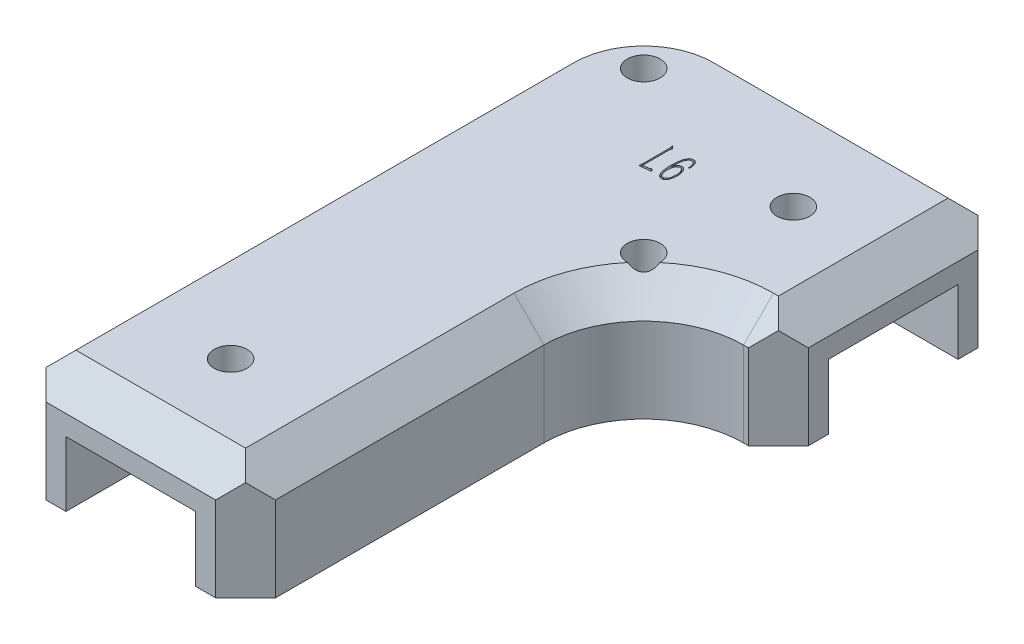
from build123d import *

# Parameters (mm, degrees)
SKETCH_1_W          = 23
SKETCH_1_H          = 23
SKETCH_1_W_2        = 13
SKETCH_1_H_2        = 13
EXTRUDE_1_DEPTH     = 62.9
SKETCH_2_R          = 1.65
CUT_EXTRUDE_1_DEPTH = 34
SKETCH_4_W          = 23
SKETCH_4_H          = 23
SKETCH_4_R          = 3
EXTRUDE_2_DEPTH     = 3.5
SKETCH_5_W          = 23
SKETCH_5_H          = 23
SKETCH_5_W_2        = 13
SKETCH_5_H_2        = 13
EXTRUDE_1_2_DEPTH   = 10
SKETCH_6_R          = 1.65
CUT_EXTRUDE_2_DEPTH = 39
SKETCH_7_W          = 13
SKETCH_7_H          = 13
CUT_EXTRUDE_3_DEPTH = 13
CHAMFER_1_SIZE      = 3
SKETCH_8_W          = 36.5
SKETCH_8_H          = 62.9
CUT_EXTRUDE_4_DEPTH = 11.5
EXTRUDE_3_DEPTH     = 6.5
FILLET_1_R          = 10
FILLET_2_R          = 10
SKETCH_10_R         = 1.65
CUT_EXTRUDE_5_DEPTH = 28.5
CHAMFER_3_SIZE      = 3
CHAMFER_4_SIZE      = 3
CHAMFER_5_SIZE      = 3
CUT_EXTRUDE_6_DEPTH = 0.3


with BuildPart() as part:
    # 草图1 → Extrude 1 (new body)
    with BuildSketch(Plane.XY):
        with Locations((6.5, 6.5)):
            Rectangle(SKETCH_1_W, SKETCH_1_H)
        with Locations((6.5, 6.5)):
            Rectangle(SKETCH_1_W_2, SKETCH_1_H_2, mode=Mode.SUBTRACT)
    extrude(amount=EXTRUDE_1_DEPTH)

    # 草图2 → 切除-拉伸1 (cut)
    with BuildSketch(Plane.XZ.offset(5)):
        with Locations(Location((6.5, 52.9, 0), (0, 0, 270))):
            Circle(SKETCH_2_R)
    extrude(amount=-CUT_EXTRUDE_1_DEPTH, mode=Mode.SUBTRACT)

    # 草图4 → 凸台-拉伸2 (add)
    with BuildSketch(Plane(origin=(18, 0, 0), x_dir=(0, 0, -1), z_dir=(1, 0, 0))):
        with Locations((-11.5, 6.5)):
            Rectangle(SKETCH_4_W, SKETCH_4_H)
        with Locations(Location((-11.5, 6.5, 0), (0, 0, 90))):
            Circle(SKETCH_4_R, mode=Mode.SUBTRACT)
    extrude(amount=EXTRUDE_2_DEPTH)

    # 草图5 → Extrude 1 2 (add)
    with BuildSketch(Plane(origin=(21.5, 0, 0), x_dir=(0, 0, -1), z_dir=(1, 0, 0))):
        with Locations((-11.5, 6.5)):
            Rectangle(SKETCH_5_W, SKETCH_5_H)
        with Locations((-11.5, 6.5)):
            Rectangle(SKETCH_5_W_2, SKETCH_5_H_2, mode=Mode.SUBTRACT)
    extrude(amount=EXTRUDE_1_2_DEPTH)

    # 草图6 → 切除-拉伸2 (cut)
    with BuildSketch(Plane(origin=(0, 18, 0), x_dir=(1, 0, 0), z_dir=(0, 1, 0))):
        with Locations(Location((21.5, -11.5, 0), (0, 0, 270))):
            Circle(SKETCH_6_R)
    extrude(amount=-CUT_EXTRUDE_2_DEPTH, mode=Mode.SUBTRACT)

    # 草图7 → 切除-拉伸3 (cut)
    with BuildSketch(Plane(origin=(21.5, 0, 0), x_dir=(0, 0, -1), z_dir=(1, 0, 0))):
        with Locations((-11.5, 6.5)):
            Rectangle(SKETCH_7_W, SKETCH_7_H)
    extrude(amount=-CUT_EXTRUDE_3_DEPTH, mode=Mode.SUBTRACT)

    # 倒角1
    chamfer_1_edges = [part.edges().sort_by_distance(p)[0] for p in [
        (13, 6.5, 18),
    ]]
    chamfer(chamfer_1_edges, length=CHAMFER_1_SIZE)

    # 草图8 → 切除-拉伸4 (cut)
    with BuildSketch(Plane.XZ.offset(5)):
        with Locations((13.25, 31.45)):
            Rectangle(SKETCH_8_W, SKETCH_8_H)
    extrude(amount=-CUT_EXTRUDE_4_DEPTH, mode=Mode.SUBTRACT)

    # 草图9 → 凸台-拉伸3 (add)
    with BuildSketch(Plane.XZ.offset(-13)):
        Polygon((13, 5), (0, 18), (0, 0), (13, 0), align=None)
    extrude(amount=EXTRUDE_3_DEPTH)

    # 圆角1
    fillet_1_edges = [part.edges().sort_by_distance(p)[0] for p in [
        (-5, 12.25, 0),
    ]]
    fillet(fillet_1_edges, radius=FILLET_1_R)

    # 圆角2
    fillet_2_edges = [part.edges().sort_by_distance(p)[0] for p in [
        (18, 12.25, 23),
    ]]
    fillet(fillet_2_edges, radius=FILLET_2_R)

    # 草图10 → 切除-拉伸5 (cut)
    with BuildSketch(Plane.XZ.offset(-6.5)):
        with Locations(Location((2, 7, 0), (0, 0, 270))):
            Circle(SKETCH_10_R)
        with Locations(Location((18, 23, 0), (0, 0, 270))):
            Circle(SKETCH_10_R)
    extrude(amount=-CUT_EXTRUDE_5_DEPTH, mode=Mode.SUBTRACT)

    # 倒角3
    # the kernel refuses this chamfer: 3 mm, written as the material it takes off along each edge
    with BuildSketch(Plane(origin=(5, 18, 10), x_dir=(0, 0, -1), z_dir=(1, 0, 0))) as chamfer_3_piece_1:
        Polygon((10 - CHAMFER_3_SIZE, 0), (10, -CHAMFER_3_SIZE), (10, 0), align=None)
    revolve(axis=Axis((5, 18, 10), (0, 1, 0)), revolution_arc=90, mode=Mode.SUBTRACT)
    with BuildSketch(Plane(origin=(28, 18, 33), x_dir=(-1, 0, 0), z_dir=(0, 0, 1))) as chamfer_3_piece_2:
        Polygon((10 + CHAMFER_3_SIZE, 0), (10, CHAMFER_3_SIZE), (10, 0), align=None)
    revolve(axis=Axis((28, 18, 33), (0, -1, 0)), revolution_arc=90, mode=Mode.SUBTRACT)
    with BuildSketch(Plane(origin=(28, 18, 23), x_dir=(0, 0.027495876610586768, -0.9996219169112968), z_dir=(1, 0, 0))) as chamfer_3_piece_3:
        Polygon((CHAMFER_3_SIZE * 0.999621916911, -CHAMFER_3_SIZE * 0.0274958766106), (-CHAMFER_3_SIZE * 0.0274958766106, -CHAMFER_3_SIZE * 0.999621916911), (0, 0), align=None)
    extrude(amount=11.215048964, mode=Mode.SUBTRACT)
    with BuildSketch(Plane(origin=(39.215048964, 18, 0), x_dir=(0, 0.027495876610586778, 0.9996219169112968), z_dir=(-1, 0, 0))) as chamfer_3_piece_4:
        Polygon((CHAMFER_3_SIZE * 0.999621916911, -CHAMFER_3_SIZE * 0.0274958766106), (-CHAMFER_3_SIZE * 0.0274958766106, -CHAMFER_3_SIZE * 0.999621916911), (0, 0), align=None)
    extrude(amount=34.215048964, mode=Mode.SUBTRACT)
    with BuildSketch(Plane(origin=(-5, 18, 10), x_dir=(0.9996219169112968, 0.027495876610586778, 0), z_dir=(0, 0, 1))) as chamfer_3_piece_5:
        Polygon((CHAMFER_3_SIZE * 0.999621916911, -CHAMFER_3_SIZE * 0.0274958766106), (-CHAMFER_3_SIZE * 0.0274958766106, -CHAMFER_3_SIZE * 0.999621916911), (0, 0), align=None)
    extrude(amount=60.615048964, mode=Mode.SUBTRACT)
    with BuildSketch(Plane(origin=(18, 18, 33), x_dir=(-0.9996219169112968, 0.02749587661058678, 0), z_dir=(0, 0, 1))) as chamfer_3_piece_6:
        Polygon((CHAMFER_3_SIZE * 0.999621916911, CHAMFER_3_SIZE * 0.0274958766106), (-CHAMFER_3_SIZE * 0.0274958766106, CHAMFER_3_SIZE * 0.999621916911), (0, 0), align=None)
    extrude(amount=37.615048964, mode=Mode.SUBTRACT)

    # 倒角4
    chamfer_4_edges = [part.edges().sort_by_distance(p)[0] for p in [
        (31.5, 18, 11.5),
        (6.5, 18, 62.9),
    ]]
    chamfer(chamfer_4_edges, length=CHAMFER_4_SIZE)

    # 倒角5
    chamfer_5_edges = [part.edges().sort_by_distance(p)[0] for p in [
        (31.5, 10.75, 0),
        (18, 10.75, 62.9),
        (-5, 10.75, 62.9),
        (31.5, 10.75, 23),
    ]]
    chamfer(chamfer_5_edges, length=CHAMFER_5_SIZE)

    # 草图11 → 切除-拉伸6 (cut)
    # profile 1 of 2: a face of its own
    with BuildSketch(Plane(origin=(0, 18, 0), x_dir=(1, 0, 0), z_dir=(0, 1, 0))):
        with BuildLine():
            Line((10.169961689, -12.331537965), (10.205013894, -12.291265218))
            Line((10.205013894, -12.291265218), (10.426514001, -12.567953904))
            add(Edge.make_bspline(
                [(10.426514001, -12.567953904), (10.420112222, -12.579915965), (10.407467454, -12.603543377), (10.386569123, -12.639943921), (10.370185964, -12.685502621), (10.359588371, -12.742805909), (10.35209593, -12.811137632), (10.351500935, -12.860031707), (10.351189049, -12.885661127)],
                knots=[0, 0, 0, 0, 0.736410598, 1.454555069, 2.274010016, 3.348139226, 4.609940921, 6, 6, 6, 6], degree=3))
            Line((10.351189049, -12.885661127), (10.351189049, -15.45267583))
            add(Edge.make_bspline(
                [(10.351189049, -15.45267583), (10.371826596, -15.452896348), (10.409627863, -15.453300265), (10.460307316, -15.45086352), (10.499898624, -15.451081152), (10.532243392, -15.448383736), (10.566728187, -15.443767174), (10.611448589, -15.437841115), (10.671205536, -15.430596017), (10.740781303, -15.42063203), (10.811376358, -15.410141046), (10.873070645, -15.400698583), (10.921027088, -15.392273183), (10.96613794, -15.38446762), (11.010436775, -15.369094836), (11.049310442, -15.340736904), (11.074303969, -15.311966685), (11.093758709, -15.304642687), (11.100709611, -15.302025926)],
                knots=[0, 0, 0, 0, 1.271684107, 2.329311289, 3.126176351, 3.710204741, 4.32783396, 5.270448411, 6.49050515, 8.03759688, 9.602040843, 10.889228832, 11.884182716, 12.602334394, 13.712376462, 14.732953672, 15.547302315, 16, 16, 16, 16], degree=3))
            add(Edge.make_bspline(
                [(11.100709611, -15.302025926), (11.103959736, -15.304489051), (11.113400688, -15.311643929), (11.132267838, -15.327898493), (11.163548601, -15.353676179), (11.201478257, -15.390427651), (11.240409179, -15.42644517), (11.271376905, -15.455066249), (11.293619074, -15.475482172), (11.302231693, -15.496622164), (11.305824587, -15.513703571), (11.306858546, -15.523764644), (11.307293886, -15.528000782)],
                knots=[0, 0, 0, 0, 0.390394386, 1.134016561, 2.38360509, 4.269889804, 6.18981564, 7.453157385, 8.329021544, 9.032311711, 9.592562279, 10, 10, 10, 10], degree=3))
            add(Edge.make_bspline(
                [(11.307293886, -15.528000782), (11.305212221, -15.532796655), (11.301026913, -15.542439033), (11.286239348, -15.55179173), (11.267131043, -15.556758669), (11.233888241, -15.556197885), (11.186258933, -15.554623782), (11.124477681, -15.564210462), (11.05816542, -15.573408269), (11.005527492, -15.581639095), (10.965535977, -15.587447027), (10.936371989, -15.590018683), (10.899642796, -15.594141501), (10.855080644, -15.59744449), (10.802889633, -15.602073636), (10.742973465, -15.607248202), (10.67539132, -15.613397762), (10.627634367, -15.617061001), (10.60252082, -15.618987358)],
                knots=[0, 0, 0, 0, 0.341365878, 0.68633572, 1.116730632, 1.647491765, 2.890856209, 4.29325764, 5.800779701, 7.359923239, 7.845242571, 8.495183841, 9.311733456, 10.309872826, 11.474601469, 12.805924266, 14.320358265, 16, 16, 16, 16], degree=3))
            Line((10.60252082, -15.618987358), (10.391461796, -15.639123731))
            Line((10.391461796, -15.639123731), (10.275118305, -15.648819022))
            add(Edge.make_bspline(
                [(10.275118305, -15.648819022), (10.263007492, -15.652765111), (10.243378711, -15.659160794), (10.214432, -15.655040492), (10.201866673, -15.638282344), (10.192131638, -15.619901093), (10.192866545, -15.591243902), (10.198261256, -15.551485761), (10.205237773, -15.496760287), (10.208454509, -15.455416407), (10.210234436, -15.432539457)],
                knots=[0, 0, 0, 0, 1.058270145, 1.715207142, 2.242218181, 2.723015089, 3.427046488, 4.550153686, 6.091084828, 8, 8, 8, 8], degree=3))
            Line((10.210234436, -15.432539457), (10.219929727, -15.135714398))
            Line((10.219929727, -15.135714398), (10.219929727, -12.869999504))
            add(Edge.make_bspline(
                [(10.219929727, -12.869999504), (10.220035325, -12.841906978), (10.220225034, -12.791438493), (10.219121537, -12.724573471), (10.218920574, -12.674829063), (10.216657144, -12.63033937), (10.213948744, -12.583085364), (10.209857543, -12.52449073), (10.200503917, -12.456208353), (10.187043548, -12.40845637), (10.17965698, -12.382251794)],
                knots=[0, 0, 0, 0, 1.372323329, 2.465391677, 3.267017655, 3.801925377, 4.641299591, 5.579257235, 6.671583216, 8, 8, 8, 8], degree=3))
            Line((10.17965698, -12.382251794), (10.169961689, -12.331537965))
        make_face()
    # profile 2 of 2: a face of its own
    with BuildSketch(Plane(origin=(0, 18, 0), x_dir=(1, 0, 0), z_dir=(0, 1, 0))):
        with BuildLine():
            Line((12.942814875, -13.383849919), (12.872710464, -13.383849919))
            add(Edge.make_bspline(
                [(12.872710464, -13.383849919), (12.867918886, -13.353809877), (12.858438492, -13.294374035), (12.849706726, -13.203550372), (12.83905791, -13.109176046), (12.820825233, -13.009319563), (12.79213831, -12.905502921), (12.751787805, -12.822970037), (12.713616192, -12.761128168), (12.681074416, -12.719772821), (12.643740897, -12.68513145), (12.60383766, -12.655968298), (12.560867121, -12.633421198), (12.515816463, -12.617151626), (12.46800517, -12.609872771), (12.419341648, -12.610331281), (12.37196, -12.615849571), (12.327948721, -12.627325085), (12.288264417, -12.642859648), (12.251427379, -12.663429677), (12.217626053, -12.693175443), (12.182369113, -12.73045195), (12.147000859, -12.779042444), (12.109980412, -12.836434778), (12.074100881, -12.903470073), (12.042445574, -12.979778402), (12.014177787, -13.064293467), (11.981349351, -13.189191417), (11.950908708, -13.356894625), (11.932652427, -13.528473707), (11.924020532, -13.663229848), (11.919736569, -13.753495496), (11.916223971, -13.831794896), (11.915974323, -13.880046822), (11.915859835, -13.902175084)],
                knots=[0, 0, 0, 0, 1.172618578, 2.320089015, 3.517365984, 4.833421129, 6.231766425, 7.655217032, 8.357323983, 9.032478261, 9.676711985, 10.315215253, 10.932648665, 11.54199308, 12.153444918, 12.786093219, 13.413857257, 13.988112725, 14.53457488, 15.054145165, 15.605211832, 16.262994999, 17.029841423, 17.917944275, 18.895673466, 19.956732694, 21.09950916, 22.329492637, 24.933332206, 27.662278065, 28.97833321, 30.139613505, 31.146829503, 32, 32, 32, 32], degree=3))
            Line((11.915859835, -13.902175084), (11.911385086, -14.098318276))
            add(Edge.make_bspline(
                [(11.911385086, -14.098318276), (11.923834505, -14.063189828), (11.946336992, -13.999694701), (11.980887158, -13.912091477), (12.020008929, -13.837807929), (12.065615005, -13.769118356), (12.124632618, -13.705721256), (12.184922335, -13.659402751), (12.241612947, -13.627387084), (12.291956123, -13.609038819), (12.348639061, -13.596364249), (12.388627507, -13.592472653), (12.409573877, -13.590434194)],
                knots=[0, 0, 0, 0, 1.463710204, 2.645675197, 3.693667506, 4.755032446, 5.874045908, 7.078730407, 7.725382873, 8.423483439, 9.174203962, 10, 10, 10, 10], degree=3))
            add(Edge.make_bspline(
                [(12.409573877, -13.590434194), (12.439835126, -13.591591348), (12.497383672, -13.593791936), (12.580232678, -13.618560704), (12.657683928, -13.662024086), (12.717344383, -13.715168011), (12.765506198, -13.767614813), (12.800980306, -13.815640946), (12.83559675, -13.86996529), (12.880092113, -13.951367182), (12.928072791, -14.062381272), (12.96274157, -14.181006946), (12.980750115, -14.281516051), (12.992492769, -14.362531543), (12.998711178, -14.448994823), (13.002334613, -14.569872825), (13.000558726, -14.720743995), (12.992331534, -14.840657004), (12.988308163, -14.899298459)],
                knots=[0, 0, 0, 0, 0.909148716, 1.728949998, 2.576991438, 3.564625719, 4.121218537, 4.72026629, 5.360049571, 6.060456872, 7.512703724, 8.993852322, 9.770776208, 10.587253518, 11.458483217, 12.380006039, 14.229702395, 16, 16, 16, 16], degree=3))
            add(Edge.make_bspline(
                [(12.988308163, -14.899298459), (12.983608116, -14.929675901), (12.973860322, -14.992678041), (12.953205559, -15.089864753), (12.927868491, -15.19309581), (12.898759968, -15.298586031), (12.865056127, -15.398748972), (12.820466317, -15.484106806), (12.766539325, -15.551118503), (12.70422983, -15.597317433), (12.642693157, -15.627760558), (12.587657462, -15.651328091), (12.539752875, -15.66833624), (12.509108536, -15.672365551), (12.495339912, -15.674175937)],
                knots=[0, 0, 0, 0, 1.110217054, 2.302565578, 3.587623031, 4.949459538, 6.256081064, 7.397105523, 8.411240029, 9.334418742, 10.173869837, 10.886090718, 11.499516107, 12, 12, 12, 12], degree=3))
            add(Edge.make_bspline(
                [(12.495339912, -15.674175937), (12.470213796, -15.676282338), (12.420118214, -15.68048201), (12.35684791, -15.668988814), (12.306109765, -15.651276018), (12.264992877, -15.630107878), (12.219298731, -15.604464513), (12.171688318, -15.57097854), (12.123314851, -15.532029135), (12.080029096, -15.483908729), (12.040141389, -15.430188824), (11.994152314, -15.348900857), (11.945784339, -15.241043373), (11.900910188, -15.129057625), (11.872023575, -15.029968363), (11.852437657, -14.941217661), (11.833916104, -14.838201609), (11.817915581, -14.725910345), (11.803798949, -14.614957849), (11.791998912, -14.515471595), (11.782018513, -14.432747788), (11.772938084, -14.34482367), (11.766603475, -14.247085007), (11.764555812, -14.131880233), (11.766516457, -14.010541481), (11.7690752, -13.926534252), (11.770430472, -13.882038711)],
                knots=[0, 0, 0, 0, 0.848219995, 1.691151707, 2.144998995, 2.659153853, 3.249319417, 3.912736756, 4.621867519, 5.340468245, 6.090710837, 6.87657341, 8.487178015, 10.078339935, 10.944022033, 11.968008362, 13.14490399, 14.476453821, 15.796264219, 16.920399402, 17.85823784, 18.608902694, 19.903936842, 21.162934464, 22.497310667, 24, 24, 24, 24], degree=3))
            add(Edge.make_bspline(
                [(11.770430472, -13.882038711), (11.771327858, -13.846485859), (11.773016259, -13.779594321), (11.776837417, -13.685624172), (11.780784559, -13.604510622), (11.789230244, -13.511458816), (11.803144805, -13.39744376), (11.825085762, -13.25792114), (11.850828027, -13.117956151), (11.878891146, -13.005409005), (11.905895261, -12.919269954), (11.931277234, -12.853378891), (11.963178755, -12.785907457), (11.997835599, -12.716461615), (12.0374126, -12.650488401), (12.080994362, -12.591165841), (12.128035304, -12.541079834), (12.178389948, -12.498680209), (12.235228677, -12.466647739), (12.298659551, -12.444011953), (12.369607576, -12.432284686), (12.418981842, -12.432242001), (12.444626083, -12.432219832)],
                knots=[0, 0, 0, 0, 1.211628523, 2.279639787, 3.204225299, 3.977932759, 5.462339825, 7.116605252, 8.789327199, 10.30942825, 11.064792467, 11.863814246, 12.712679163, 13.606614715, 14.50718602, 15.330439464, 16.109367713, 16.843542067, 17.564206182, 18.319665359, 19.127259812, 20, 20, 20, 20], degree=3))
            add(Edge.make_bspline(
                [(12.444626083, -12.432219832), (12.47061728, -12.434371472), (12.519733425, -12.438437474), (12.587433315, -12.456871949), (12.64558744, -12.481350088), (12.691625485, -12.516048591), (12.727754813, -12.554311881), (12.761140383, -12.589067483), (12.787400935, -12.624285691), (12.810241334, -12.658831833), (12.829130287, -12.697187767), (12.848050578, -12.740562468), (12.865551481, -12.791607385), (12.882564162, -12.847431062), (12.898444852, -12.903639632), (12.911970266, -12.955836672), (12.922441107, -13.001847585), (12.93303939, -13.057349854), (12.941823915, -13.13025522), (12.942465646, -13.190159282), (12.942814875, -13.222758932)],
                knots=[0, 0, 0, 0, 1.358046768, 2.566331314, 3.646368544, 4.629682629, 5.546946845, 6.391627168, 7.141431054, 7.835891544, 8.549473584, 9.368770778, 10.304200405, 11.362836174, 12.414134618, 13.351720444, 14.176238426, 14.875889185, 16.299866179, 18, 18, 18, 18], degree=3))
            Line((12.942814875, -13.222758932), (12.942814875, -13.383849919))
        make_face()
        with BuildLine():
            add(Edge.make_bspline(
                [(11.976268955, -14.627084524), (11.977776853, -14.671882646), (11.980871547, -14.763822908), (11.999676029, -14.903263912), (12.032371025, -15.044733228), (12.071441669, -15.160657463), (12.110199634, -15.249260952), (12.145017863, -15.309099013), (12.182766953, -15.363622531), (12.225939236, -15.410442099), (12.273415518, -15.450201741), (12.328278603, -15.475240996), (12.387676021, -15.489995311), (12.42862973, -15.488501786), (12.449846624, -15.487728035)],
                knots=[0, 0, 0, 0, 1.4886747, 3.055242853, 4.666194597, 6.306608966, 7.112592917, 7.87485258, 8.603662743, 9.310999056, 9.986965693, 10.644668568, 11.297843225, 12, 12, 12, 12], degree=3))
            add(Edge.make_bspline(
                [(12.449846624, -15.487728035), (12.468144225, -15.485993629), (12.504818459, -15.482517324), (12.558075746, -15.463371912), (12.609279858, -15.434730143), (12.657334013, -15.395609478), (12.700988825, -15.349397119), (12.739842908, -15.29817881), (12.771242925, -15.241865727), (12.80406074, -15.159057279), (12.834334928, -15.045544046), (12.850986916, -14.899160399), (12.861238325, -14.746019568), (12.869143467, -14.5882095), (12.867353129, -14.424643744), (12.847724811, -14.315423703), (12.837658258, -14.259409263)],
                knots=[0, 0, 0, 0, 0.542441635, 1.087226227, 1.660703064, 2.273516638, 2.914006631, 3.539772715, 4.172601069, 4.816509057, 6.173746714, 7.636628278, 9.17189136, 10.71932084, 12.317475397, 14, 14, 14, 14], degree=3))
            add(Edge.make_bspline(
                [(12.837658258, -14.259409263), (12.82399313, -14.213469196), (12.796840697, -14.122186881), (12.745016517, -14.015996971), (12.696932685, -13.940158115), (12.661390115, -13.890695756), (12.621692603, -13.852576503), (12.582203855, -13.82183798), (12.540935352, -13.800372642), (12.500002975, -13.783702204), (12.45731544, -13.776497191), (12.428980465, -13.776256704), (12.414794419, -13.776136303)],
                knots=[0, 0, 0, 0, 2.076888393, 4.126750173, 5.096135134, 5.973977047, 6.759453719, 7.47553224, 8.136547057, 8.771446398, 9.384918551, 10, 10, 10, 10], degree=3))
            add(Edge.make_bspline(
                [(12.414794419, -13.776136303), (12.397510458, -13.778810286), (12.362707489, -13.784194617), (12.312564999, -13.802566768), (12.264502935, -13.829255277), (12.20627226, -13.875471723), (12.142523312, -13.940136066), (12.093239672, -14.014751967), (12.064219981, -14.080438774), (12.043430704, -14.136629411), (12.025034737, -14.20154504), (12.007945337, -14.273883659), (11.993923907, -14.353544569), (11.983427158, -14.439406041), (11.977675077, -14.531295867), (11.976747119, -14.594510755), (11.976268955, -14.627084524)],
                knots=[0, 0, 0, 0, 0.703513377, 1.416593983, 2.138698186, 2.910269809, 4.405335412, 5.780974721, 6.484987373, 7.296510348, 8.193863016, 9.202460595, 10.29132512, 11.452082192, 12.687092747, 14, 14, 14, 14], degree=3))
        make_face(mode=Mode.SUBTRACT)
    extrude(amount=-CUT_EXTRUDE_6_DEPTH, mode=Mode.SUBTRACT)


solid = part.part
